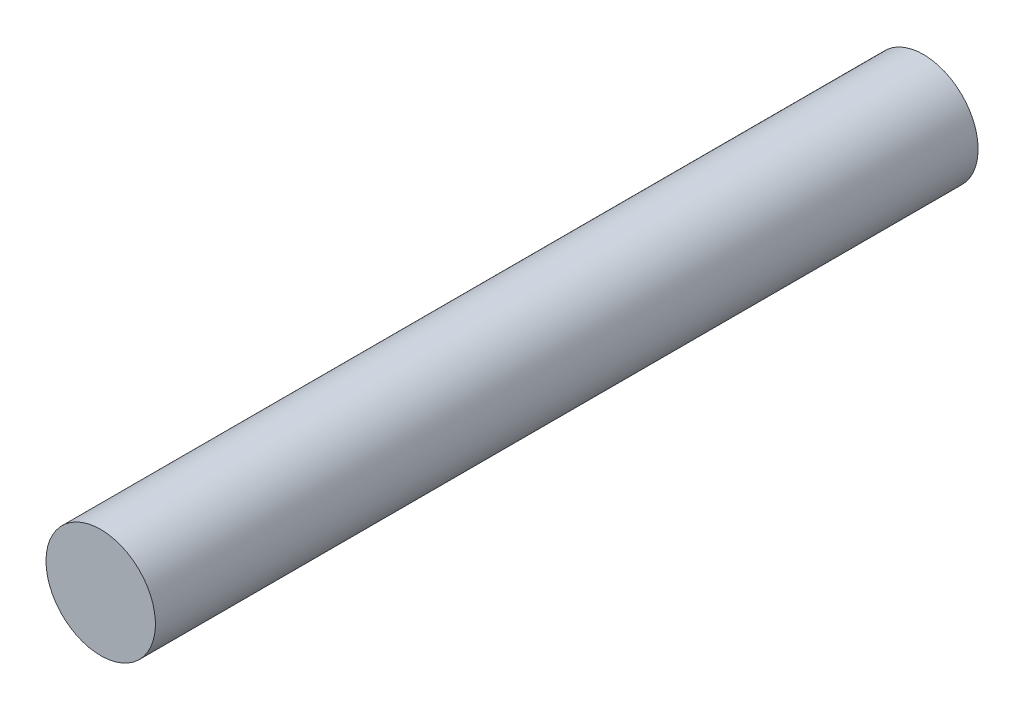
from build123d import *

# Parameters (mm, degrees)
SKETCH1_R           = 3.175
BOSS_EXTRUDE1_DEPTH = 47.752


with BuildPart() as part:
    # Sketch1 → Boss-Extrude1 (new body)
    with BuildSketch(Plane.XY):
        Circle(SKETCH1_R)
    extrude(amount=BOSS_EXTRUDE1_DEPTH)


solid = part.part
